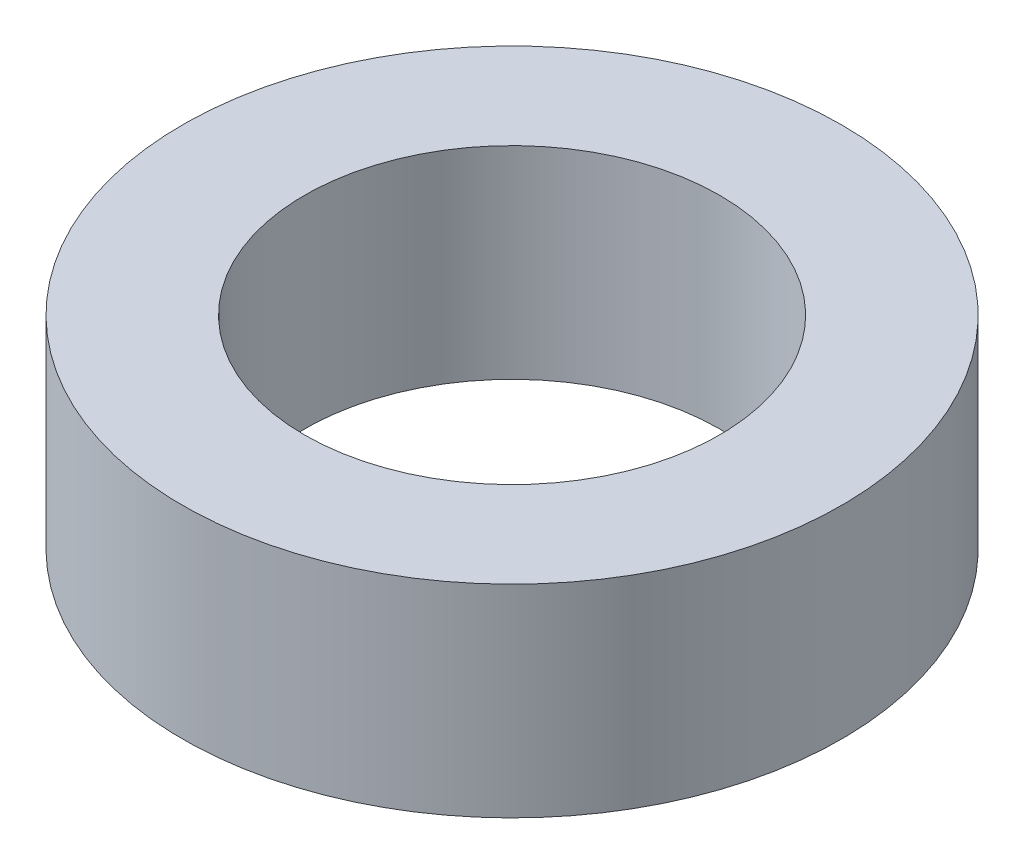
from build123d import *

# Parameters (mm, degrees)
SKETCH1_R           = 6.35
BOSS_EXTRUDE1_DEPTH = 3.900000052
SKETCH3_R           = 4
CUT_EXTRUDE2_DEPTH  = 10.790556695


with BuildPart() as part:
    # Sketch1 → Boss-Extrude1 (new body)
    with BuildSketch(Plane(origin=(0, 0, 0), x_dir=(1, 0, 0), z_dir=(0, 1, 0))):
        Circle(SKETCH1_R)
    extrude(amount=BOSS_EXTRUDE1_DEPTH)

    # Sketch3 → Cut-Extrude2 (cut, through all)
    with BuildSketch(Plane(origin=(0, 3.900000052, 0), x_dir=(1, 0, 0), z_dir=(0, 1, 0))):
        Circle(SKETCH3_R)
    extrude(amount=-CUT_EXTRUDE2_DEPTH, mode=Mode.SUBTRACT)


solid = part.part
